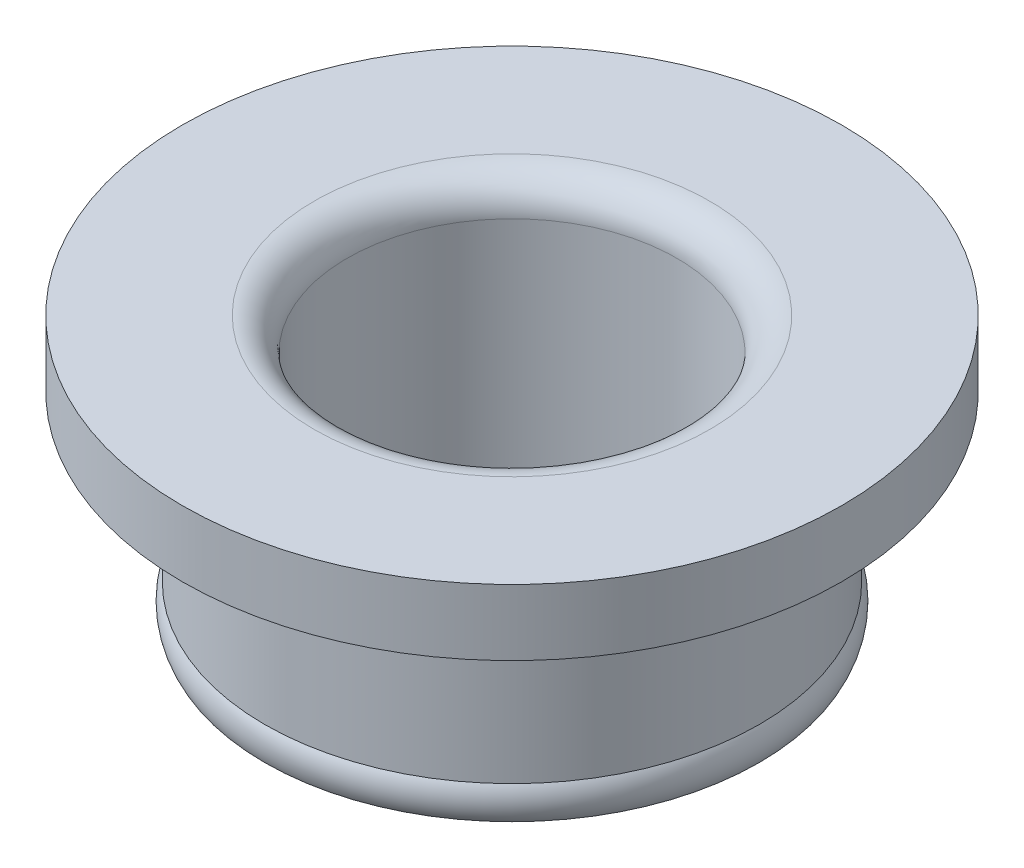
from build123d import *

# Parameters (mm, degrees)
SKETCH1_R           = 12.7
SKETCH1_R_2         = 6.35
BOSS_EXTRUDE1_DEPTH = 2.54
BOSS_EXTRUDE2_START = -7.62
SKETCH1_3_R         = 9.525
SKETCH1_3_R_2       = 6.35
BOSS_EXTRUDE2_DEPTH = 7.62
FILLET1_R           = 1.27
FILLET2_R           = 0.762


with BuildPart() as part:
    # Sketch1 → Boss-Extrude1 (new body)
    with BuildSketch(Plane(origin=(0, 0, 0), x_dir=(1, 0, 0), z_dir=(0, 1, 0))):
        Circle(SKETCH1_R)
        Circle(SKETCH1_R_2, mode=Mode.SUBTRACT)
    extrude(amount=BOSS_EXTRUDE1_DEPTH)

    # Sketch1<3> → Boss-Extrude2 (add)
    with BuildSketch(Plane(origin=(0, 0, 0), x_dir=(1, 0, 0), z_dir=(0, 1, 0)).offset(BOSS_EXTRUDE2_START)):
        Circle(SKETCH1_3_R)
        Circle(SKETCH1_3_R_2, mode=Mode.SUBTRACT)
    extrude(amount=BOSS_EXTRUDE2_DEPTH)

    # Fillet1
    fillet1_edges = [part.edges().sort_by_distance(p)[0] for p in [
        (-6.35, 2.54, 0),
    ]]
    fillet(fillet1_edges, radius=FILLET1_R)

    # Fillet2
    fillet2_edges = [part.edges().sort_by_distance(p)[0] for p in [
        (-9.525, 0, 0),
    ]]
    fillet(fillet2_edges, radius=FILLET2_R)

    # Sketch2 → Revolve1 (revolve)
    with BuildSketch(Plane(origin=(0, 0, 0), x_dir=(0, 0, -1), z_dir=(1, 0, 0))):
        with BuildLine():
            Line((9.525, -6.35), (9.525, -7.62))
            ThreePointArc((9.525, -7.62), (9.695147737, -6.985), (9.525, -6.35))
        make_face()
    revolve(axis=Axis((0, 3.048, 0), (0, -1, 0)))


solid = part.part
